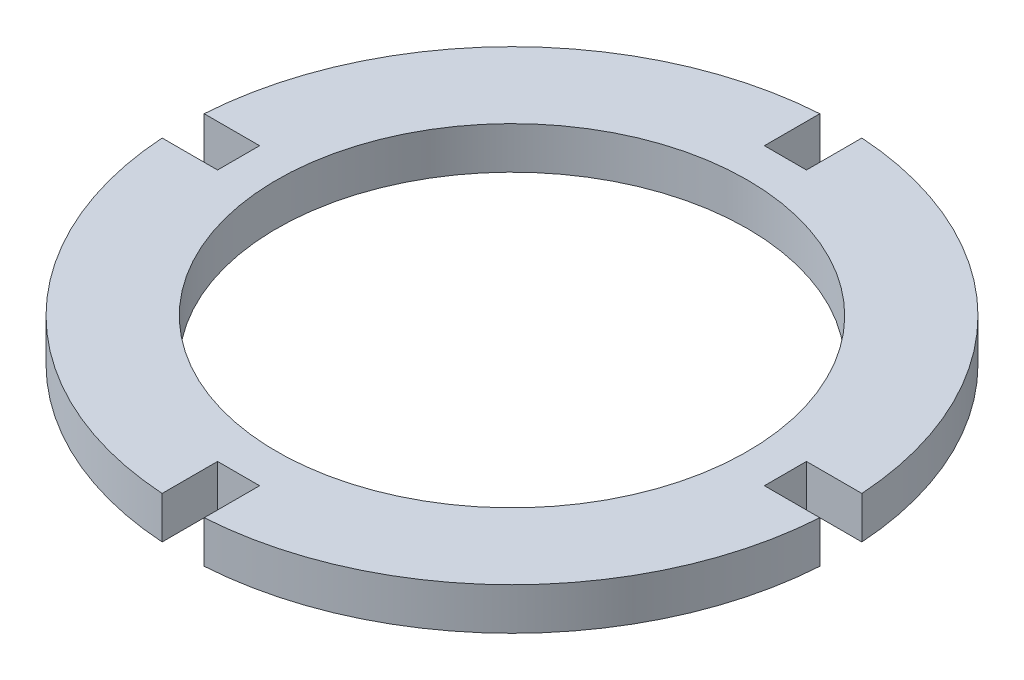
from build123d import *

# Parameters (mm, degrees)
SKICA4_R                 = 23.5
P_IDAT_VYSUNUT_M1_DEPTH  = 3
SKICA6_R                 = 16.78
ODEBRAT_VYSUNUT_M2_DEPTH = 3
SKICA7_W                 = 3
SKICA7_H                 = 6.382195619
SKICA7_W_2               = 6.382195619
SKICA7_H_2               = 3
ODEBRAT_VYSUNUT_M3_DEPTH = 3


with BuildPart() as part:
    # Skica4 → Přidat vysunutím1 (new body)
    with BuildSketch(Plane(origin=(0, 0, 0), x_dir=(1, 0, 0), z_dir=(0, 1, 0))):
        Circle(SKICA4_R)
    extrude(amount=P_IDAT_VYSUNUT_M1_DEPTH)

    # Skica6 → Odebrat vysunutím2 (cut)
    with BuildSketch(Plane.XZ):
        Circle(SKICA6_R)
    extrude(amount=-ODEBRAT_VYSUNUT_M2_DEPTH, mode=Mode.SUBTRACT)

    # Skica7 → Odebrat vysunutím3 (cut)
    with BuildSketch(Plane(origin=(0, 3, 0), x_dir=(1, 0, 0), z_dir=(0, 1, 0))):
        with Locations((0, -22.69109781)):
            Rectangle(SKICA7_W, SKICA7_H)
        with Locations((22.69109781, 0)):
            Rectangle(SKICA7_W_2, SKICA7_H_2)
        with Locations((-22.69109781, 0)):
            Rectangle(SKICA7_W_2, SKICA7_H_2)
        with Locations((0, 22.69109781)):
            Rectangle(SKICA7_W, SKICA7_H)
    extrude(amount=-ODEBRAT_VYSUNUT_M3_DEPTH, mode=Mode.SUBTRACT)


solid = part.part
